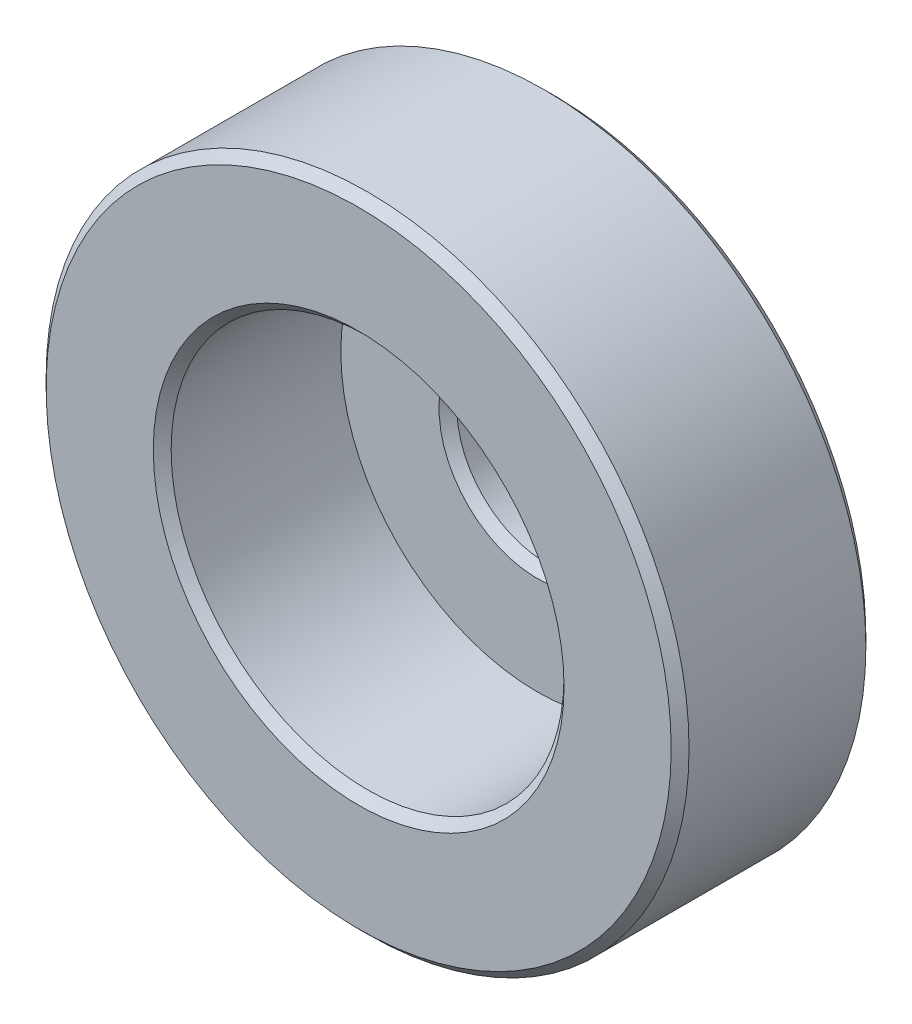
from build123d import *

# Parameters (mm, degrees)
CUT_EXTRUDE1_START = -1.5
CUT_EXTRUDE1_DEPTH = 1.5
CHAMFER1_SIZE      = 0.5


with BuildPart() as part:
    # Sketch2 → Revolve1 (revolve)
    with BuildSketch(Plane(origin=(0, 0, 0), x_dir=(1, 0, 0), z_dir=(0, 1, 0))):
        Polygon((-18, -4.5), (-11, -4.5), (-11, 0), (-5, 0), (-5, -5.4), (-11, -5.4), (-11, -15.4), (-18, -15.4), align=None)
    revolve(axis=Axis((0, 0, 0), (0, 0, 1)))

    # Sketch3 → Cut-Extrude1 (cut)
    with BuildSketch(Plane(origin=(0, 0, 0), x_dir=(-1, 0, 0), z_dir=(0, 0, -1)).offset(CUT_EXTRUDE1_START)):
        with BuildLine():
            Line((1.25, 10.940968966), (1.25, 4.841229183))
            ThreePointArc((1.25, 4.841229183), (0, 5), (-1.25, 4.841229183))
            Line((-1.25, 4.841229183), (-1.25, 10.940968966))
            ThreePointArc((-1.25, 10.940968966), (0, 11.012143385), (1.25, 10.940968966))
        make_face()
        with BuildLine():
            Line((1.25, -4.841229183), (1.25, -10.940968966))
            ThreePointArc((1.25, -10.940968966), (0, -11.012143385), (-1.25, -10.940968966))
            Line((-1.25, -10.940968966), (-1.25, -4.841229183))
            ThreePointArc((-1.25, -4.841229183), (0, -5), (1.25, -4.841229183))
        make_face()
    extrude(amount=CUT_EXTRUDE1_DEPTH, mode=Mode.SUBTRACT)

    # Chamfer1
    chamfer1_edges = [part.edges().sort_by_distance(p)[0] for p in [
        (5, 0, 5.4),
        (11, 0, 15.4),
        (18, 0, 15.4),
        (18, 0, 4.5),
        (-8.20822758, 7.322909258, 0),
        (11, 0, 0),
    ]]
    chamfer(chamfer1_edges, length=CHAMFER1_SIZE)


solid = part.part
